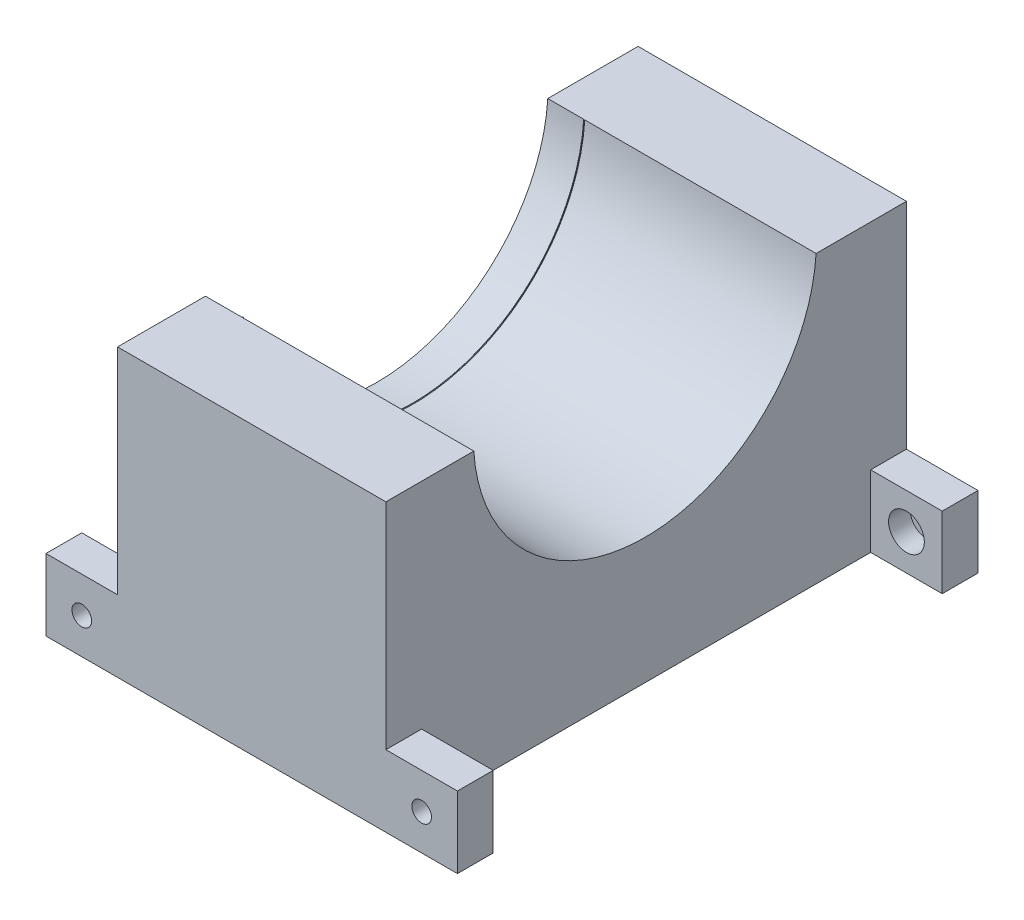
from build123d import *

# Parameters (mm, degrees)
SKETCH1_W           = 115
SKETCH1_H           = 20
BOSS_EXTRUDE2_DEPTH = 10
SKETCH5_W           = 75
SKETCH5_H           = 20
BOSS_EXTRUDE3_DEPTH = 62.75
SKETCH6_R           = 5
CUT_EXTRUDE1_DEPTH  = 6
SKETCH7_R           = 2.75
CUT_EXTRUDE2_DEPTH  = 233.838060677
SKETCH8_W           = 75
SKETCH8_H           = 145.5
BOSS_EXTRUDE4_DEPTH = 60


# Read off the part's stored shape, not the designer's step: Cavity1
with BuildPart() as part:
    # Sketch1 → Boss-Extrude2 (new body)
    with BuildSketch(Plane.XY):
        with Locations((-166.5, 0)):
            Rectangle(SKETCH1_W, SKETCH1_H)
    boss_extrude2 = extrude(amount=BOSS_EXTRUDE2_DEPTH)

    # Sketch5 → Boss-Extrude3 (add)
    with BuildSketch(Plane.XY.offset(10)):
        with Locations((-166.5, 0)):
            Rectangle(SKETCH5_W, SKETCH5_H)
    boss_extrude3 = extrude(amount=BOSS_EXTRUDE3_DEPTH)

    # Sketch6 → Cut-Extrude1 (cut)
    with BuildSketch(Plane.XY.offset(10)):
        with Locations((-214, 0)):
            Circle(SKETCH6_R)
        with Locations((-119, 0)):
            Circle(SKETCH6_R)
    cut_extrude1 = extrude(amount=-CUT_EXTRUDE1_DEPTH, mode=Mode.SUBTRACT)

    # Sketch7 → Cut-Extrude2 (cut, through all)
    with BuildSketch(Plane.XY.offset(10)):
        with Locations((-214, 0)):
            Circle(SKETCH7_R)
        with Locations((-119, 0)):
            Circle(SKETCH7_R)
    cut_extrude2 = extrude(amount=-CUT_EXTRUDE2_DEPTH, mode=Mode.SUBTRACT)

    # Mirror2: Boss-Extrude2, Boss-Extrude3, Cut-Extrude1, Cut-Extrude2 across plane
    add(boss_extrude2.mirror(Plane.XY.offset(72.75)))
    add(boss_extrude3.mirror(Plane.XY.offset(72.75)))
    add(cut_extrude1.mirror(Plane.XY.offset(72.75)), mode=Mode.SUBTRACT)
    add(cut_extrude2.mirror(Plane.XY.offset(72.75)), mode=Mode.SUBTRACT)

    # Sketch8 → Boss-Extrude4 (add)
    with BuildSketch(Plane(origin=(0, 10, 0), x_dir=(1, 0, 0), z_dir=(0, 1, 0))):
        with Locations((-166.5, -72.75)):
            Rectangle(SKETCH8_W, SKETCH8_H)
    extrude(amount=BOSS_EXTRUDE4_DEPTH)

    # Cavity1 outline → Cavity1 (revolve, cut)
    with BuildSketch(Plane(origin=(0, 73.114724575, 73.090002845), x_dir=(0, 1, 0), z_dir=(0, 0, -1))):
        with BuildLine():
            add(Edge.make_bspline(
                [(47.94959748, -204), (47.942690938, -201.049048949), (47.938709825, -197.719672316), (47.938508062, -193.954796221)],
                knots=[0.884714855, 0.884714855, 0.884714855, 0.884714855, 0.997011473, 0.997011473, 0.997011473, 0.997011473], degree=3))
            Line((47.938508062, -193.954796221), (47.637, -193.653288159))
            Line((47.637, -193.653288159), (47.9385, -193.653288159))
            Line((47.9385, -193.653288159), (47.9385, -129))
            Line((47.9385, -129), (0, -129))
            Line((0, -129), (0, -204.0000001))
            Line((0, -204.0000001), (47.94959748, -204))
        make_face()
    revolve(axis=Axis((0, 73.114724575, 73.090002845), (1, 0, 0)), mode=Mode.SUBTRACT)


solid = part.part
